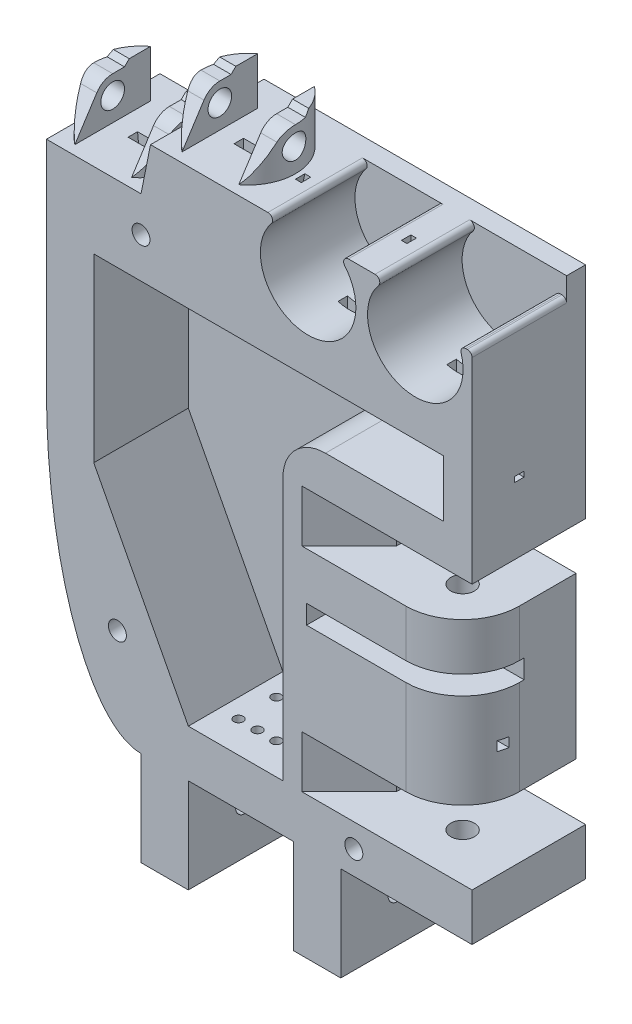
from build123d import *

# Parameters (mm, degrees)
SKETCH2_W                      = 114.3
SKETCH2_H                      = 142.875
BOSS_EXTRUDE2_DEPTH            = 30.48
FILLET1_SIZE                   = 25.4
FILLET1_SIZE_2                 = 71.501
BOSS_EXTRUDE3_DEPTH            = 11.43
CUT_EXTRUDE2_DEPTH             = 25.4
FILLET2_R                      = 1.27
SKETCH7_W                      = 27.94
SKETCH7_H                      = 30.48
CUT_EXTRUDE4_DEPTH             = 12.7
BOSS_EXTRUDE4_DEPTH            = 11.43
CUT_EXTRUDE6_DEPTH             = 25.4
CUT_EXTRUDE7_DEPTH             = 171.262283535
CUT_EXTRUDE7_DEPTH_BACK        = 171.262283535
SKETCH11_R                     = 3.175
CUT_EXTRUDE8_REACH             = 185.225
SKETCH12_R                     = 3.175
CUT_EXTRUDE8_DIRECTION_2_DEPTH = 184.224735996
CHAMFER1_SIZE2                 = 12.7
CHAMFER1_SIZE                  = 2.54
SKETCH13_W                     = 7.62
SKETCH13_H                     = 5.08
CUT_EXTRUDE9_DEPTH             = 25.4
FILLET4_R                      = 1.27
CUT_EXTRUDE10_DEPTH            = 195.431359314
CHAMFER2_SIZE                  = 12.7
CUT_EXTRUDE11_REACH            = 196.431
SKETCH15_R                     = 3.175
BOSS_EXTRUDE5_DEPTH            = 1.27
CHAMFER3_SIZE                  = 1.27
BOSS_EXTRUDE6_DEPTH            = 1.27
CHAMFER4_SIZE                  = 1.27
FILLET5_R                      = 15.24
CUT_EXTRUDE12_DEPTH            = 16.51
SKETCH20_W                     = 2.54
SKETCH20_H                     = 2.54
CUT_EXTRUDE13_DEPTH            = 171.777226453
FILLET6_R                      = 1.27
CUT_EXTRUDE14_DEPTH            = 1.27
CUT_EXTRUDE14_DEPTH_BACK       = 1.27
SKETCH21_W                     = 5.08
SKETCH21_H                     = 33.02
SKETCH21_H_2                   = 10.329873089
SKETCH21_H_3                   = 10.221702335
SKETCH21_W_2                   = 7.62
SKETCH21_H_4                   = 1.402013576
SKETCH21_W_3                   = 1.485233779
FILLET7_R                      = 11.43
SKETCH22_R                     = 1.27
CUT_EXTRUDE15_DEPTH            = 12.7
CUT_EXTRUDE16_DEPTH            = 196.440786647
CUT_EXTRUDE16_DEPTH_BACK       = 196.440786647
SKETCH23_R                     = 2.413
SKETCH24_W                     = 12.7
SKETCH24_H                     = 30.48
BOSS_EXTRUDE7_DEPTH            = 25.4
SKETCH25_R                     = 2.54
CUT_EXTRUDE17_DEPTH            = 178.14615249


# Some blends are built 0.0001 mm under size
with BuildPart() as part:
    # Sketch2 → Boss-Extrude2 (new body)
    with BuildSketch(Plane.XY):
        with Locations((57.15, 71.4375)):
            Rectangle(SKETCH2_W, SKETCH2_H)
    extrude(amount=BOSS_EXTRUDE2_DEPTH)

    # Fillet1
    # an asymmetric fillet: 71.501, 25.4 mm, written as the material it takes off along each edge
    with BuildSketch(Plane(origin=(0, 0, -178.7525), x_dir=(1, 0, 0), z_dir=(0, 0, 1))) as fillet1_piece_1:
        with BuildLine():
            Bezier((FILLET1_SIZE, 0), (0, 0), (0, FILLET1_SIZE_2), weights=[1, 0.707106781, 1])
            Line((0, FILLET1_SIZE_2), (0, 0))
            Line((0, 0), (FILLET1_SIZE, 0))
        make_face()
    extrude(amount=387.985, mode=Mode.SUBTRACT)

    # Sketch3 → Boss-Extrude3 (add)
    with BuildSketch(Plane(origin=(0, 142.875, 0), x_dir=(1, 0, 0), z_dir=(0, 1, 0))):
        with BuildLine():
            Line((33.866582, -7.62), (33.866582, -27.94))
            ThreePointArc((33.866582, -27.94), (28.786582, -17.78), (33.866582, -7.62))
        make_face()
        with BuildLine():
            Line((49.106582, -7.62), (49.106582, -27.94))
            ThreePointArc((49.106582, -27.94), (54.186582, -17.78), (49.106582, -7.62))
        make_face()
    extrude(amount=BOSS_EXTRUDE3_DEPTH)

    # Sketch5 → Cut-Extrude2 (cut)
    with BuildSketch(Plane.XY.offset(30.48)):
        with BuildLine():
            Line((62.653333333, 142.875), (77.893333333, 142.875))
            ThreePointArc((77.893333333, 142.875), (70.273333333, 119.729689625), (62.653333333, 142.875))
        make_face()
        with BuildLine():
            Line((91.44, 142.875), (106.68, 142.875))
            ThreePointArc((106.68, 142.875), (99.06, 119.729689625), (91.44, 142.875))
        make_face()
    extrude(amount=-CUT_EXTRUDE2_DEPTH, mode=Mode.SUBTRACT)

    # Fillet2
    fillet2_edges = [part.edges().sort_by_distance(p)[0] for p in [
        (77.893333333, 142.875, 17.78),
        (62.653333333, 142.875, 17.78),
        (91.44, 142.875, 17.78),
    ]]
    fillet(fillet2_edges, radius=FILLET2_R)

    # Sketch7 → Cut-Extrude4 (cut)
    with BuildSketch(Plane(origin=(0, 142.875, 0), x_dir=(1, 0, 0), z_dir=(0, 1, 0))):
        with Locations((13.97, -15.24)):
            Rectangle(SKETCH7_W, SKETCH7_H)
    extrude(amount=-CUT_EXTRUDE4_DEPTH, mode=Mode.SUBTRACT)

    # Sketch8 → Boss-Extrude4 (add)
    with BuildSketch(Plane(origin=(0, 130.175, 0), x_dir=(1, 0, 0), z_dir=(0, 1, 0))):
        with BuildLine():
            Line((5.08, -7.62), (5.08, -27.94))
            ThreePointArc((5.08, -27.94), (0, -17.78), (5.08, -7.62))
        make_face()
        with BuildLine():
            Line((20.32, -7.62), (20.32, -27.94))
            ThreePointArc((20.32, -27.94), (25.4, -17.78), (20.32, -7.62))
        make_face()
    extrude(amount=BOSS_EXTRUDE4_DEPTH)

    # Sketch10 → Cut-Extrude6 (cut)
    with BuildSketch(Plane.XY.offset(30.48)):
        Polygon((63.5, 109.855), (12.7, 109.855), (12.7, 61.2775), (38.1, 12.7), (63.5, 12.7), (63.5, 94.615), (106.68, 94.615), (106.68, 109.855), align=None)
    extrude(amount=-CUT_EXTRUDE6_DEPTH, mode=Mode.SUBTRACT)

    # Sketch11 → Cut-Extrude7 (cut, two sides: drawn at the far end of the back side and taken through both)
    with BuildSketch(Plane.ZY.offset(-49.106582).offset(-CUT_EXTRUDE7_DEPTH_BACK)):
        with Locations((17.78, 149.225)):
            Circle(SKETCH11_R)
        with BuildLine():
            Line((22.044917923, 151.984868677), (27.94, 142.875))
            Line((27.94, 142.875), (27.94, 154.305))
            Line((27.94, 154.305), (17.78, 154.305))
            ThreePointArc((17.78, 154.305), (20.207577715, 153.687428312), (22.044917923, 151.984868677))
        make_face()
    extrude(amount=CUT_EXTRUDE7_DEPTH + CUT_EXTRUDE7_DEPTH_BACK, mode=Mode.SUBTRACT)

    # Cut-Extrude8: up to this face of the body (flat: up to its plane)
    cut_extrude8_end = Plane(part.part.faces().sort_by_distance((27.94, 136.525, 15.24))[0])
    # Sketch12 → Cut-Extrude8 (cut, up to the picked face)
    with BuildSketch(Plane.ZY.offset(-20.32), mode=Mode.PRIVATE) as cut_extrude8_sk1:
        with Locations((17.78, 136.525)):
            Circle(SKETCH12_R)
    cut_extrude8_tool1 = split(extrude(cut_extrude8_sk1.sketch, amount=-CUT_EXTRUDE8_REACH, mode=Mode.PRIVATE), bisect_by=cut_extrude8_end, keep=Keep.BOTH, mode=Mode.PRIVATE)
    # Sketch12 → Cut-Extrude8 (cut, up to the picked face)
    with BuildSketch(Plane.ZY.offset(-20.32), mode=Mode.PRIVATE) as cut_extrude8_sk2:
        with BuildLine():
            Line((22.044917923, 139.284868677), (27.94, 130.175))
            Line((27.94, 130.175), (27.94, 141.605))
            Line((27.94, 141.605), (17.78, 141.605))
            ThreePointArc((17.78, 141.605), (20.207577715, 140.987428312), (22.044917923, 139.284868677))
        make_face()
    cut_extrude8_tool2 = split(extrude(cut_extrude8_sk2.sketch, amount=-CUT_EXTRUDE8_REACH, mode=Mode.PRIVATE), bisect_by=cut_extrude8_end, keep=Keep.BOTH, mode=Mode.PRIVATE)
    add(cut_extrude8_tool1.solids().sort_by(Axis((20.32, 136.525, 17.78), (1, 0, 0)))[0], mode=Mode.SUBTRACT)
    add(cut_extrude8_tool2.solids().sort_by(Axis((20.32, 137.885407, 25.333291), (1, 0, 0)))[0], mode=Mode.SUBTRACT)

    # Sketch12 → Cut-Extrude8 direction 2 (cut)
    with BuildSketch(Plane.ZY.offset(-20.32)):
        with Locations((17.78, 136.525)):
            Circle(SKETCH12_R)
        with BuildLine():
            Line((22.044917923, 139.284868677), (27.94, 130.175))
            Line((27.94, 130.175), (27.94, 141.605))
            Line((27.94, 141.605), (17.78, 141.605))
            ThreePointArc((17.78, 141.605), (20.207577715, 140.987428312), (22.044917923, 139.284868677))
        make_face()
    extrude(amount=CUT_EXTRUDE8_DIRECTION_2_DEPTH, mode=Mode.SUBTRACT)

    # Chamfer1
    chamfer1_edges = [part.edges().sort_by_distance(p)[0] for p in [
        (27.94, 130.175, 15.24),
    ]]
    chamfer1_side = [part.faces().sort_by_distance(p)[0] for p in [
        (27.8892, 130.175, 15.24),
    ]]
    chamfer(chamfer1_edges, length=CHAMFER1_SIZE - 0.0001, length2=CHAMFER1_SIZE2 - 0.0001, reference=chamfer1_side[0])  # a hair under: the kernel refuses the full size

    # Sketch13 → Cut-Extrude9 (cut)
    with BuildSketch(Plane.XY.offset(30.48)):
        with Locations((110.49, 140.335)):
            Rectangle(SKETCH13_W, SKETCH13_H)
    extrude(amount=-CUT_EXTRUDE9_DEPTH, mode=Mode.SUBTRACT)

    # Fillet4
    fillet4_edges = [part.edges().sort_by_distance(p)[0] for p in [
        (110.768630723, 137.795, 17.78),
        (114.3, 137.795, 17.78),
    ]]
    fillet(fillet4_edges, radius=FILLET4_R)

    # Sketch14 → Cut-Extrude10 (cut, through all)
    with BuildSketch(Plane.XY.offset(30.48)):
        Polygon((114.3, 12.7), (81.28, 12.7), (81.28, 26.67), (111.76, 26.67), (111.76, 69.85), (81.28, 69.85), (81.28, 83.82), (114.3, 83.82), align=None)
    extrude(amount=-CUT_EXTRUDE10_DEPTH, mode=Mode.SUBTRACT)

    # Chamfer2
    chamfer2_edges = [part.edges().sort_by_distance(p)[0] for p in [
        (81.28, 76.835, 30.48),
        (81.28, 19.685, 30.48),
    ]]
    chamfer(chamfer2_edges, length=CHAMFER2_SIZE)

    # Cut-Extrude11: up to this face of the body (flat: up to its plane)
    cut_extrude11_end = Plane(part.part.faces().sort_by_distance((59.69, 109.855, 17.78))[0])
    # Sketch15 → Cut-Extrude11 (cut, up to the picked face)
    with BuildSketch(Plane.XZ, mode=Mode.PRIVATE) as cut_extrude11_sk1:
        with Locations(Location((99.06, 17.78, 0), (0, 0, 270))):
            Circle(SKETCH15_R)
    cut_extrude11_tool1 = split(extrude(cut_extrude11_sk1.sketch, amount=-CUT_EXTRUDE11_REACH, mode=Mode.PRIVATE), bisect_by=cut_extrude11_end, keep=Keep.BOTH, mode=Mode.PRIVATE)
    add(cut_extrude11_tool1.solids().sort_by(Axis((99.06, 0, 17.78), (0, 1, 0)))[0], mode=Mode.SUBTRACT)

    # Sketch16 → Boss-Extrude5 (add)
    with BuildSketch(Plane(origin=(0, 141.605, 0), x_dir=(1, 0, 0), z_dir=(0, 1, 0))):
        with BuildLine():
            Line((0.406992957, -14.590646171), (5.08, -14.605))
            Line((5.08, -14.605), (5.08, -7.62))
            ThreePointArc((5.08, -7.62), (2.151092977, -10.708185479), (0.406992957, -14.590646171))
        make_face()
        with BuildLine():
            Line((20.32, -14.605), (24.996722124, -14.605))
            ThreePointArc((24.996722124, -14.605), (23.253033275, -10.714344425), (20.32, -7.62))
            Line((20.32, -7.62), (20.32, -14.605))
        make_face()
    extrude(amount=BOSS_EXTRUDE5_DEPTH)

    # Chamfer3
    chamfer3_edges = [part.edges().sort_by_distance(p)[0] for p in [
        (22.658361062, 142.875, 14.605),
        (2.743496479, 142.875, 14.597823086),
    ]]
    chamfer(chamfer3_edges, length=CHAMFER3_SIZE - 0.0001)  # a hair under: the kernel refuses the full size

    # Sketch17 → Boss-Extrude6 (add)
    with BuildSketch(Plane(origin=(0, 154.305, 0), x_dir=(1, 0, 0), z_dir=(0, 1, 0))):
        with BuildLine():
            Line((29.150536334, -14.761394806), (33.866582, -14.761394806))
            Line((33.866582, -14.761394806), (33.866582, -7.62))
            ThreePointArc((33.866582, -7.62), (30.888902084, -10.781487273), (29.150536334, -14.761394806))
        make_face()
        with BuildLine():
            Line((49.106582, -14.761394806), (53.822627666, -14.761394806))
            ThreePointArc((53.822627666, -14.761394806), (52.084261916, -10.781487273), (49.106582, -7.62))
            Line((49.106582, -7.62), (49.106582, -14.761394806))
        make_face()
    extrude(amount=BOSS_EXTRUDE6_DEPTH)

    # Chamfer4
    chamfer4_edges = [part.edges().sort_by_distance(p)[0] for p in [
        (51.464604833, 155.575, 14.761394806),
        (31.508559167, 155.575, 14.761394806),
    ]]
    chamfer(chamfer4_edges, length=CHAMFER4_SIZE - 0.0001)  # a hair under: the kernel refuses the full size

    # Fillet5
    fillet5_edges = [part.edges().sort_by_distance(p)[0] for p in [
        (111.76, 48.26, 30.48),
    ]]
    fillet(fillet5_edges, radius=FILLET5_R)

    # Sketch19 → Cut-Extrude12 (cut)
    with BuildSketch(Plane.XY.offset(30.48)):
        Polygon((81.28, 52.07), (111.76, 52.07), (111.76, 57.15), (81.28, 57.15), (69.85, 57.15), (69.85, 52.07), align=None)
    extrude(amount=-CUT_EXTRUDE12_DEPTH, mode=Mode.SUBTRACT)

    # Sketch20 → Cut-Extrude13 (cut, through all)
    with BuildSketch(Plane.ZY.offset(-63.5)):
        with Locations((19.05, 39.37)):
            Rectangle(SKETCH20_W, SKETCH20_H)
    extrude(amount=-CUT_EXTRUDE13_DEPTH, mode=Mode.SUBTRACT)

    # Fillet6
    fillet6_edges = [part.edges().sort_by_distance(p)[0] for p in [
        (63.5, 38.1, 19.05),
    ]]
    fillet(fillet6_edges, radius=FILLET6_R)

    # Sketch21 → Cut-Extrude14 (cut, two sides: drawn at the far end of the back side and taken through both)
    with BuildSketch(Plane.XY.offset(17.78).offset(-CUT_EXTRUDE14_DEPTH_BACK)):
        Polygon((12.7, 109.855), (10.485930724, 130.175), (15.565930724, 130.175), (17.78, 109.855), align=None)
        Polygon((55.429725371, 142.875), (50.86041281, 121.653709764), (50.86041281, 109.855), (52.449738918, 109.855), (52.449738918, 121.653709764), (57.019051479, 142.875), align=None)
        with Locations((41.486582, 126.365)):
            Rectangle(SKETCH21_W, SKETCH21_H)
        with Locations((69.426582, 115.019936545)):
            Rectangle(SKETCH21_W, SKETCH21_H_2)
        with Locations((98.636582, 114.965851168)):
            Rectangle(SKETCH21_W, SKETCH21_H_3)
        with Locations((110.49, 102.445426643)):
            Rectangle(SKETCH21_W_2, SKETCH21_H_4)
        with Locations((84.636338767, 126.365)):
            Rectangle(SKETCH21_W_3, SKETCH21_H)
    extrude(amount=CUT_EXTRUDE14_DEPTH + CUT_EXTRUDE14_DEPTH_BACK, mode=Mode.SUBTRACT)

    # Fillet7
    fillet7_edges = [part.edges().sort_by_distance(p)[0] for p in [
        (63.5, 94.615, 17.78),
    ]]
    fillet(fillet7_edges, radius=FILLET7_R)

    # Sketch22 → Cut-Extrude15 (cut)
    with BuildSketch(Plane(origin=(0, 12.7, 0), x_dir=(1, 0, 0), z_dir=(0, 1, 0))):
        with Locations(Location((43.18, -11.908276952, 0), (0, 0, 180))):
            Circle(SKETCH22_R)
        with Locations(Location((48.26, -11.908276952, 0), (0, 0, 180))):
            Circle(SKETCH22_R)
        with Locations(Location((53.34, -11.908276952, 0), (0, 0, 180))):
            Circle(SKETCH22_R)
        with Locations(Location((58.42, -11.908276952, 0), (0, 0, 180))):
            Circle(SKETCH22_R)
        with Locations(Location((43.18, -22.068276952, 0), (0, 0, 180))):
            Circle(SKETCH22_R)
        with Locations(Location((48.26, -22.068276952, 0), (0, 0, 180))):
            Circle(SKETCH22_R)
        with Locations(Location((53.34, -22.068276952, 0), (0, 0, 180))):
            Circle(SKETCH22_R)
        with Locations(Location((58.42, -22.068276952, 0), (0, 0, 180))):
            Circle(SKETCH22_R)
    extrude(amount=-CUT_EXTRUDE15_DEPTH, mode=Mode.SUBTRACT)

    # Sketch23 → Cut-Extrude16 (cut, two sides: drawn at the far end of the back side and taken through both)
    with BuildSketch(Plane(origin=(0, 0, 0), x_dir=(-1, 0, 0), z_dir=(0, 0, -1)).offset(-CUT_EXTRUDE16_DEPTH_BACK)):
        with Locations((-25.4, 120.65)):
            Circle(SKETCH23_R)
        with Locations((-19.05, 25.4)):
            Circle(SKETCH23_R)
        with Locations((-82.55, 6.35)):
            Circle(SKETCH23_R)
    extrude(amount=CUT_EXTRUDE16_DEPTH + CUT_EXTRUDE16_DEPTH_BACK, mode=Mode.SUBTRACT)

    # Sketch24 → Boss-Extrude7 (add)
    with BuildSketch(Plane.XZ):
        with Locations((31.75, 15.24)):
            Rectangle(SKETCH24_W, SKETCH24_H)
        with Locations((72.695229231, 15.24)):
            Rectangle(SKETCH24_W, SKETCH24_H)
    extrude(amount=BOSS_EXTRUDE7_DEPTH)

    # Sketch25 → Cut-Extrude17 (cut, through all)
    with BuildSketch(Plane(origin=(79.045229231, 0, 0), x_dir=(0, 0, -1), z_dir=(1, 0, 0))):
        with Locations((-15.24, -12.7)):
            Circle(SKETCH25_R)
    extrude(amount=-CUT_EXTRUDE17_DEPTH, mode=Mode.SUBTRACT)


solid = part.part
